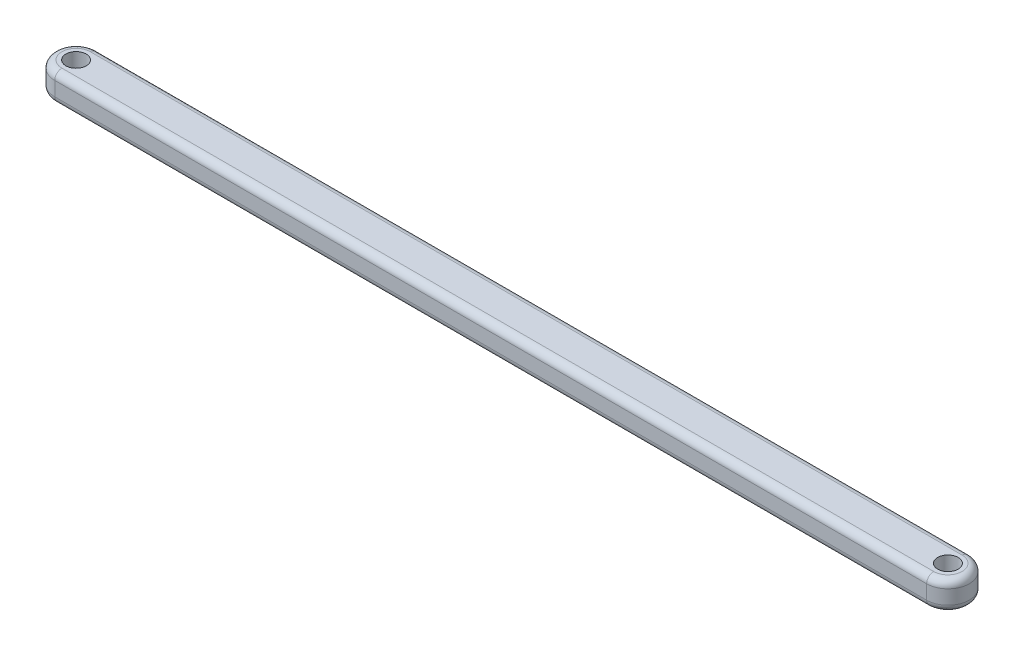
from build123d import *

# Parameters (mm, degrees)
BOSS_EXTRUDE1_DEPTH = 3.175
SKETCH2_R           = 2.286
CUT_EXTRUDE1_DEPTH  = 200.865178214
FILLET1_R           = 1.5875


with BuildPart() as part:
    # Sketch1 → Boss-Extrude1 (new, symmetric)
    with BuildSketch(Plane(origin=(0, 0, 0), x_dir=(1, 0, 0), z_dir=(0, 1, 0))):
        with BuildLine():
            Line((0, 4.7625), (194.945, 4.7625))
            ThreePointArc((194.945, 4.7625), (199.7075, 0), (194.945, -4.7625))
            Line((194.945, -4.7625), (0, -4.7625))
            ThreePointArc((0, -4.7625), (-4.7625, 0), (0, 4.7625))
        make_face()
    extrude(amount=BOSS_EXTRUDE1_DEPTH, both=True)

    # Sketch2 → Cut-Extrude1 (cut, through all)
    with BuildSketch(Plane(origin=(0, 3.175, 0), x_dir=(1, 0, 0), z_dir=(0, 1, 0))):
        Circle(SKETCH2_R)
        with Locations((194.945, 0)):
            Circle(SKETCH2_R)
    extrude(amount=-CUT_EXTRUDE1_DEPTH, mode=Mode.SUBTRACT)

    # Fillet1
    fillet1_edges = [part.edges().sort_by_distance(p)[0] for p in [
        (199.7075, -3.175, 0),
        (97.4725, -3.175, 4.7625),
        (-4.7625, -3.175, 0),
        (199.7075, 3.175, 0),
        (97.4725, 3.175, 4.7625),
        (-4.7625, 3.175, 0),
        (97.4725, -3.175, -4.7625),
        (97.4725, 3.175, -4.7625),
    ]]
    fillet(fillet1_edges, radius=FILLET1_R)


solid = part.part
